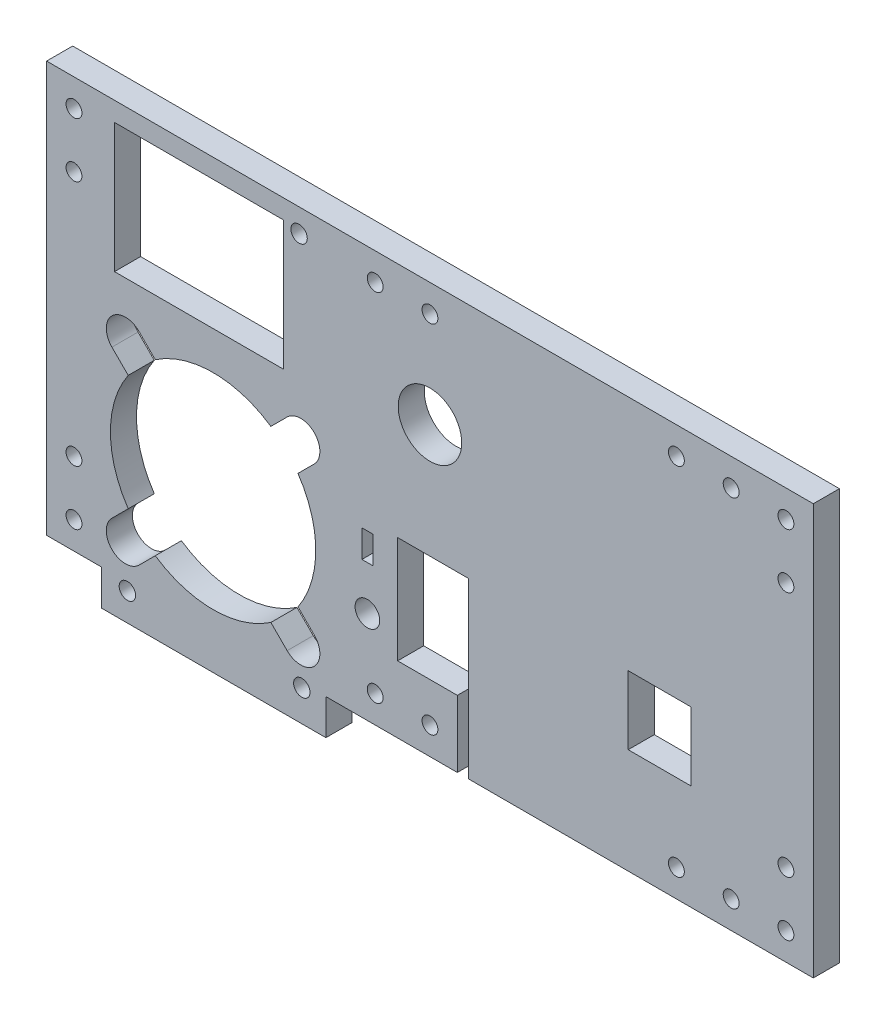
from build123d import *

# Parameters (mm, degrees)
SKETCH1_W           = 70
SKETCH1_H           = 37.5
BOSS_EXTRUDE1_DEPTH = 4.7625
SKETCH2_R           = 1.45
CUT_EXTRUDE2_DEPTH  = 80.554581303
MIRROR7_OUTLINE_W   = 140
MIRROR7_OUTLINE_H   = 37.5
MIRROR7_OUTLINE_R   = 1.45
MIRROR7_DEPTH       = 4.7625
SKETCH4_W           = 41
SKETCH4_H           = 6.5
BOSS_EXTRUDE2_DEPTH = 4.7625
SKETCH5_R           = 18.75
SKETCH5_W           = 30.85
SKETCH5_H           = 23.6
CUT_EXTRUDE3_DEPTH  = 83.817156473
CUT_EXTRUDE4_DEPTH  = 83.817156473
CUT_EXTRUDE5_DEPTH  = 83.817156473
SKETCH8_R           = 1.5
CUT_EXTRUDE6_DEPTH  = 83.817156473
SKETCH9_R           = 2.25
SKETCH9_R_2         = 5.8
SKETCH9_W           = 2
SKETCH9_H           = 5
SKETCH9_W_2         = 11.5
SKETCH9_H_2         = 12.5
CUT_EXTRUDE7_DEPTH  = 83.817156473


# Read off the part's stored shape, not the designer's step: Mirror7
with BuildPart() as part:
    # Sketch1 → Boss-Extrude1 (new body)
    with BuildSketch(Plane.XY):
        with Locations((-35, 18.75)):
            Rectangle(SKETCH1_W, SKETCH1_H)
    boss_extrude1 = extrude(amount=BOSS_EXTRUDE1_DEPTH)

    # Mirror1: Boss-Extrude1 across plane
    add(boss_extrude1.mirror(Plane(origin=(0, 0, 0), x_dir=(0, 0, 1), z_dir=(1, 0, 0))))

    # Sketch2 → Cut-Extrude2 (cut, through all)
    with BuildSketch(Plane.XY.offset(4.7625)):
        with Locations((-65, 32.5)):
            Circle(SKETCH2_R)
        with Locations((-65, 22.5)):
            Circle(SKETCH2_R)
        with Locations((65, 32.5)):
            Circle(SKETCH2_R)
        with Locations((65, 22.5)):
            Circle(SKETCH2_R)
        with Locations((55, 32.5)):
            Circle(SKETCH2_R)
        with Locations((45, 32.5)):
            Circle(SKETCH2_R)
        with Locations((-10, 32.5)):
            Circle(SKETCH2_R)
        with Locations((0, 32.5)):
            Circle(SKETCH2_R)
    extrude(amount=-CUT_EXTRUDE2_DEPTH, mode=Mode.SUBTRACT)

    # Mirror7 outline → Mirror7 (add)
    with BuildSketch(Plane.XY):
        with Locations((0, -18.75)):
            Rectangle(MIRROR7_OUTLINE_W, MIRROR7_OUTLINE_H)
        with Locations((-65, -32.5)):
            Circle(MIRROR7_OUTLINE_R, mode=Mode.SUBTRACT)
        with Locations((-10, -32.5)):
            Circle(MIRROR7_OUTLINE_R, mode=Mode.SUBTRACT)
        with Locations((-65, -22.5)):
            Circle(MIRROR7_OUTLINE_R, mode=Mode.SUBTRACT)
        with Locations((0, -32.5)):
            Circle(MIRROR7_OUTLINE_R, mode=Mode.SUBTRACT)
        with Locations((45, -32.5)):
            Circle(MIRROR7_OUTLINE_R, mode=Mode.SUBTRACT)
        with Locations((55, -32.5)):
            Circle(MIRROR7_OUTLINE_R, mode=Mode.SUBTRACT)
        with Locations((65, -32.5)):
            Circle(MIRROR7_OUTLINE_R, mode=Mode.SUBTRACT)
        with Locations((65, -22.5)):
            Circle(MIRROR7_OUTLINE_R, mode=Mode.SUBTRACT)
    extrude(amount=MIRROR7_DEPTH)

    # Sketch4 → Boss-Extrude2 (add)
    with BuildSketch(Plane.XY.offset(4.7625)):
        with Locations((-39.5, -40.75)):
            Rectangle(SKETCH4_W, SKETCH4_H)
    extrude(amount=-BOSS_EXTRUDE2_DEPTH)

    # Sketch5 → Cut-Extrude3 (cut, through all)
    with BuildSketch(Plane.XY.offset(4.7625)):
        with Locations((-39.6, -15.3)):
            Circle(SKETCH5_R)
        with Locations((-42.175, 22.2)):
            Rectangle(SKETCH5_W, SKETCH5_H)
    extrude(amount=-CUT_EXTRUDE3_DEPTH, mode=Mode.SUBTRACT)

    # Sketch6 → Cut-Extrude4 (cut, through all)
    with BuildSketch(Plane.XY.offset(4.7625)):
        with BuildLine():
            Line((-53.125126266, 3.174873734), (-21.125126266, -28.825126266))
            ThreePointArc((-21.125126266, -28.825126266), (-21.125126266, -33.774873734), (-26.074873734, -33.774873734))
            Line((-26.074873734, -33.774873734), (-58.074873734, -1.774873734))
            ThreePointArc((-58.074873734, -1.774873734), (-58.074873734, 3.174873734), (-53.125126266, 3.174873734))
        make_face()
    extrude(amount=-CUT_EXTRUDE4_DEPTH, mode=Mode.SUBTRACT)

    # Sketch7 → Cut-Extrude5 (cut, through all)
    with BuildSketch(Plane.XY.offset(4.7625)):
        with BuildLine():
            Line((-21.125126266, -1.774873734), (-53.125126266, -33.774873734))
            ThreePointArc((-53.125126266, -33.774873734), (-58.074873734, -33.774873734), (-58.074873734, -28.825126266))
            Line((-58.074873734, -28.825126266), (-26.074873734, 3.174873734))
            ThreePointArc((-26.074873734, 3.174873734), (-21.125126266, 3.174873734), (-21.125126266, -1.774873734))
        make_face()
    extrude(amount=-CUT_EXTRUDE5_DEPTH, mode=Mode.SUBTRACT)

    # Sketch8 → Cut-Extrude6 (cut, through all)
    with BuildSketch(Plane.XY.offset(4.7625)):
        with Locations((-55.25, -38.9)):
            Circle(SKETCH8_R)
        with Locations((-23.4, -38.3)):
            Circle(SKETCH8_R)
        with Locations((-23.9, 33.25)):
            Circle(SKETCH8_R)
    extrude(amount=-CUT_EXTRUDE6_DEPTH, mode=Mode.SUBTRACT)

    # Sketch9 → Cut-Extrude7 (cut, through all)
    with BuildSketch(Plane.XY.offset(4.7625)):
        with Locations((-11.424085011, -20.586550764)):
            Circle(SKETCH9_R)
        with Locations((0, 15)):
            Circle(SKETCH9_R_2)
        Polygon((-5.903, -5.8), (7, -5.8), (7, -37.5), (5, -37.5), (5, -25.3), (-5.903, -25.3), align=None)
        with Locations((-11.424085011, -10.019868106)):
            Rectangle(SKETCH9_W, SKETCH9_H)
        with Locations((41.95, -12.05)):
            Rectangle(SKETCH9_W_2, SKETCH9_H_2)
    extrude(amount=-CUT_EXTRUDE7_DEPTH, mode=Mode.SUBTRACT)


solid = part.part
